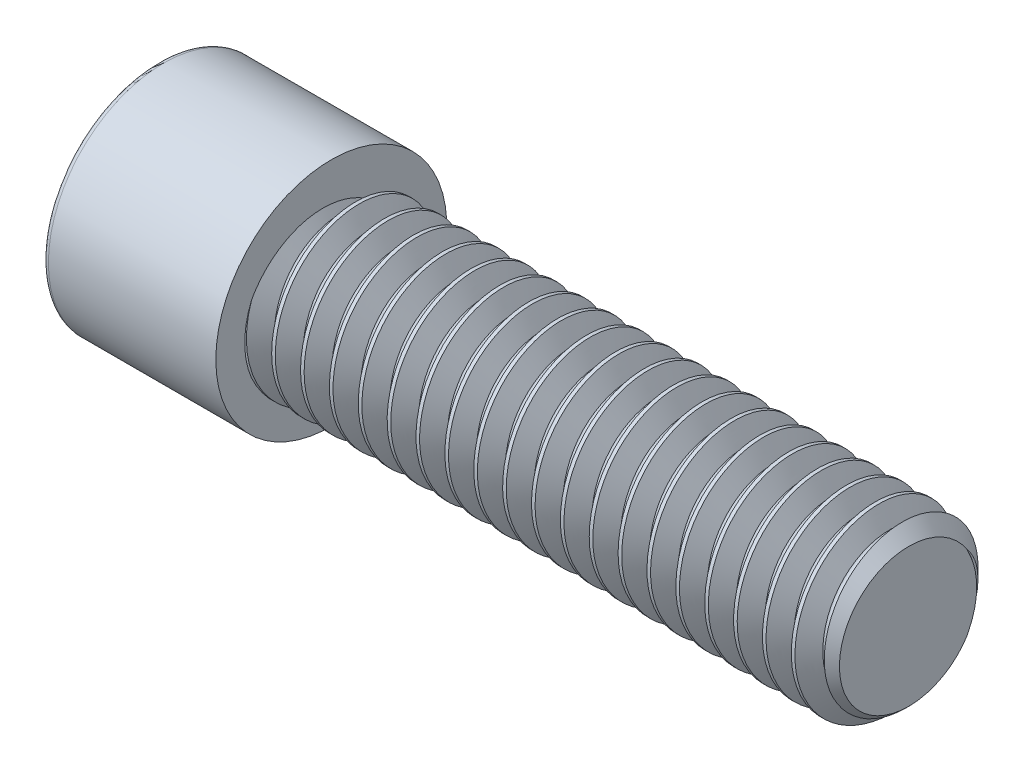
from build123d import *

# Parameters (mm, degrees)
CHAMFER1_SIZE      = 0.3
CUT_SWEEP2_PITCH   = 0.5
CUT_SWEEP2_FROM    = 0
CUT_EXTRUDE1_DEPTH = 1.5
CHAMFER2_SIZE      = 0.1
FILLET1_R          = 0.1


with BuildPart() as part:
    # Sketch1 → Revolve1 (revolve)
    with BuildSketch(Plane.XY, mode=Mode.PRIVATE) as revolve1_sk:
        Polygon((0, 0), (0, 2), (3, 2), (3, 1.5), (13, 1.5), (13, 0), align=None)
    revolve(revolve1_sk.sketch.rotate(Axis((-14.625371474, 0, 0), (1, 0, 0)), 90), axis=Axis((-14.625371474, 0, 0), (1, 0, 0)))

    # Chamfer1
    chamfer1_edges = [part.edges().sort_by_distance(p)[0] for p in [
        (13, 0, -1.5),
    ]]
    chamfer(chamfer1_edges, length=CHAMFER1_SIZE)

    # Cut-Sweep2: arcs per turn and ends read off the stored shape
    # Cut-Sweep2: the profile of Sketch5 profile screwed along a right-hand helix through 23 turns, 6 arcs to a turn; built about Z, then put on its axis
    cut_sweep2_z = Axis((0, 0, 0), (0, 0, 1))
    cut_sweep2_corners = [(1.5003, 0, -0.718924122), (1.1935, 0, -0.541793059), (1.1935, 0, -0.458206941), (1.5003, 0, -0.281075878)]
    with BuildLine(mode=Mode.PRIVATE) as cut_sweep2_profile:
        Line(cut_sweep2_corners[0], cut_sweep2_corners[1])
        Line(cut_sweep2_corners[2], cut_sweep2_corners[3])
        Line(cut_sweep2_corners[3], cut_sweep2_corners[0])
        ThreePointArc((1.1935, 0, -0.541793059), (1.177360142, 0, -0.5), (1.1935, 0, -0.458206941))
    cut_sweep2_cap = Face(cut_sweep2_profile.wire())
    cut_sweep2_arcs = [((1.1935, 0, -0.541793059), (1.155562294, 0, -0.5), (1.1935, 0, -0.458206941), (1, 0.740433557711446, 1))]  # start, shoulder, end, weights
    cut_sweep2_turn_angles = [0, 30, 60, 90, 120, 150, 180, 210, 240, 270, 300, 330, 360]
    cut_sweep2_turn_weights = [1, 0.8660254037844387, 1, 0.8660254037844387, 1, 0.8660254037844387, 1, 0.8660254037844387, 1, 0.8660254037844387, 1, 0.8660254037844387, 1]
    cut_sweep2_turn_rails = [Edge.make_bspline([Vector(p[0], p[1], 0).rotate(cut_sweep2_z, cut_sweep2_turn_angles[k]) / cut_sweep2_turn_weights[k] + Vector(0, 0, p[2] + CUT_SWEEP2_PITCH * cut_sweep2_turn_angles[k] / 360) for k in range(13)], [0, 0, 0, 1, 1, 2, 2, 3, 3, 4, 4, 5, 5, 6, 6, 6], 2, cut_sweep2_turn_weights) for p in cut_sweep2_corners]
    cut_sweep2_turn_sides = [*[Face.make_surface_from_curves(cut_sweep2_turn_rails[p[0]], cut_sweep2_turn_rails[p[1]]) for p in [(0, 1), (2, 3), (3, 0)]], *[Face.make_bezier_surface([[Vector(p[j][0], p[j][1], 0).rotate(cut_sweep2_z, cut_sweep2_turn_angles[2 * i + k]) / cut_sweep2_turn_weights[2 * i + k] + Vector(0, 0, p[j][2] + CUT_SWEEP2_PITCH * cut_sweep2_turn_angles[2 * i + k] / 360) for k in range(3)] for j in range(3)], [[p[3][j] * cut_sweep2_turn_weights[2 * i + k] for k in range(3)] for j in range(3)]) for p in cut_sweep2_arcs for i in range(6)]]
    cut_sweep2 = Plane(origin=(3, 0, 0), x_dir=(0, 0, -1), z_dir=(1, 0, 0)) * split(Solid(Shell([*[p.moved(Location((0, 0, CUT_SWEEP2_PITCH * i))) for i in range(23) for p in cut_sweep2_turn_sides], cut_sweep2_cap, cut_sweep2_cap.rotate(cut_sweep2_z, 8280).moved(Location((0, 0, CUT_SWEEP2_PITCH * 8280 / 360)))])), bisect_by=Plane.XY.offset(CUT_SWEEP2_FROM), keep=Keep.TOP, mode=Mode.PRIVATE)
    add(cut_sweep2, mode=Mode.SUBTRACT)

    # Sketch6 → Cut-Extrude1 (cut)
    with BuildSketch(Plane.ZY):
        Polygon((0.577350269, 1), (-0.577350269, 1), (-1.154700538, 0), (-0.577350269, -1), (0.577350269, -1), (1.154700538, 0), align=None)
    extrude(amount=-CUT_EXTRUDE1_DEPTH, mode=Mode.SUBTRACT)

    # Chamfer2
    chamfer2_edges = [part.edges().sort_by_distance(p)[0] for p in [
        (0, 0.5000000000000001, 0.8660254037844386),
        (0, 1, 0),
        (0, 0.5, -0.8660254037844386),
        (0, -0.4999999999999999, -0.8660254037844386),
        (0, -1, 0),
        (0, -0.5, 0.8660254037844382),
    ]]
    chamfer(chamfer2_edges, length=CHAMFER2_SIZE)

    # Fillet1
    fillet1_edges = [part.edges().sort_by_distance(p)[0] for p in [
        (0, 0, -2),
    ]]
    fillet(fillet1_edges, radius=FILLET1_R)


solid = part.part
